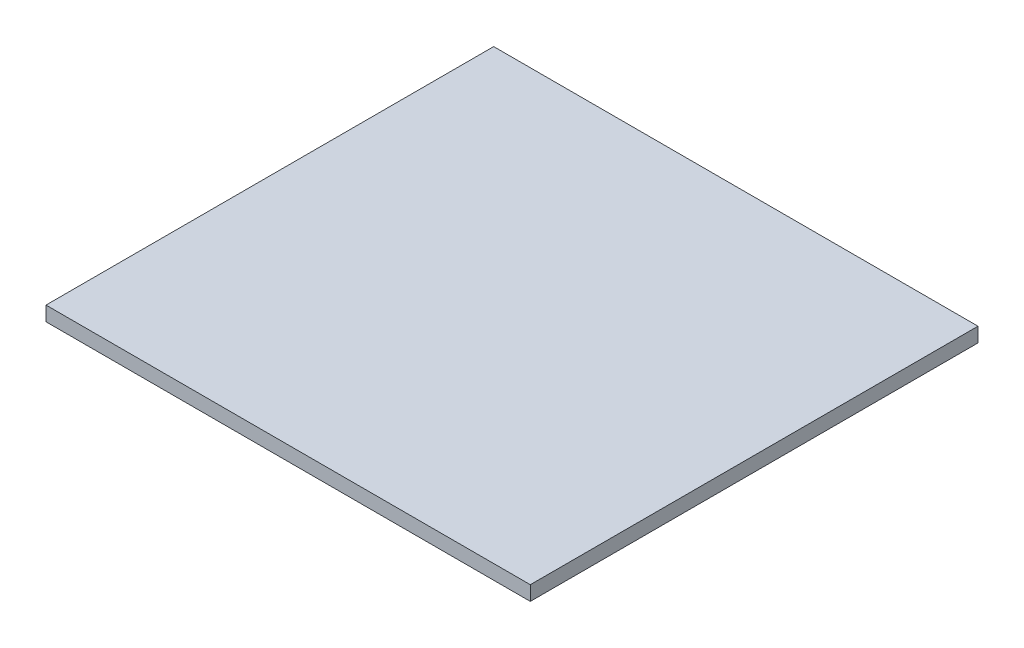
from build123d import *

# Parameters (mm, degrees)
SKETCH1_W           = 106.88
SKETCH1_H           = 98.8
BOSS_EXTRUDE1_DEPTH = 3.2


with BuildPart() as part:
    # Sketch1 → Boss-Extrude1 (new body)
    with BuildSketch(Plane(origin=(0, 0, 0), x_dir=(1, 0, 0), z_dir=(0, 1, 0))):
        with Locations((9.158457944, -28.701985981)):
            Rectangle(SKETCH1_W, SKETCH1_H)
    extrude(amount=BOSS_EXTRUDE1_DEPTH)


solid = part.part
